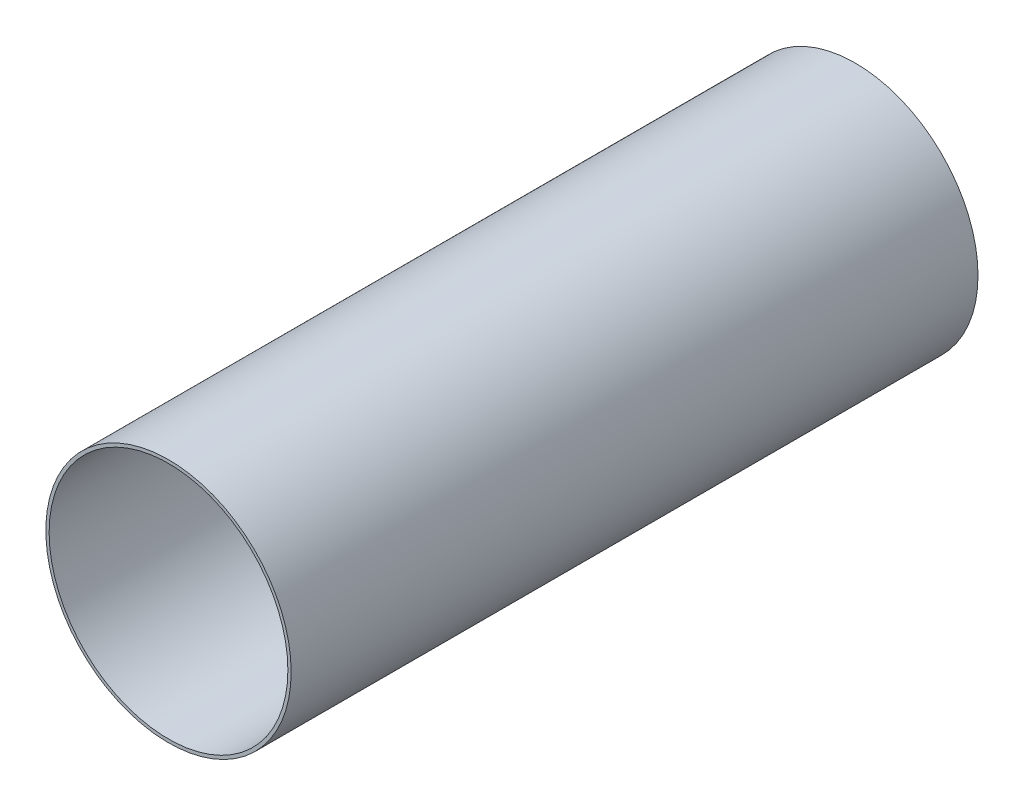
from build123d import *

# Parameters (mm, degrees)
SCHIZZO1_R                = 75
SCHIZZO1_R_2              = 73
ESTRUSIONE_SOTTILE1_DEPTH = 420


with BuildPart() as part:
    # Schizzo1 → Estrusione-Sottile1 (new body)
    with BuildSketch(Plane.XY):
        Circle(SCHIZZO1_R)
        Circle(SCHIZZO1_R_2, mode=Mode.SUBTRACT)
    extrude(amount=ESTRUSIONE_SOTTILE1_DEPTH)


solid = part.part
